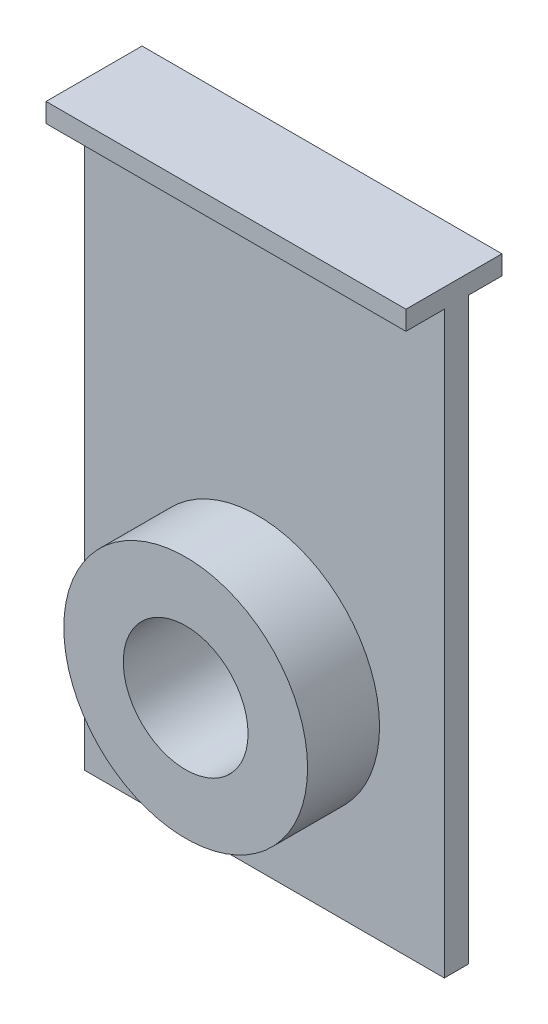
from build123d import *

# Parameters (mm, degrees)
SKETCH12_W                = 75
SKETCH12_H                = 124.71
BOSS_EXTRUDE10_DEPTH      = 5
SKETCH15_R                = 25.4
BOSS_EXTRUDE11_DEPTH      = 15
SKETCH23_R                = 13
CUT_EXTRUDE7_DEPTH        = 187.429833084
BOSS_EXTRUDE13_DEPTH      = 8
BOSS_EXTRUDE13_DEPTH_BACK = 12
SKETCH24_W                = 75
SKETCH24_H                = 4


with BuildPart() as part:
    # Sketch12 → Boss-Extrude10 (new body)
    with BuildSketch(Plane.XY):
        with Locations((99.625849364, 62.355)):
            Rectangle(SKETCH12_W, SKETCH12_H)
    extrude(amount=BOSS_EXTRUDE10_DEPTH)

    # Sketch15 → Boss-Extrude11 (add)
    with BuildSketch(Plane.XY.offset(5)):
        with Locations((98.219620603, 38.627603634)):
            Circle(SKETCH15_R)
    extrude(amount=BOSS_EXTRUDE11_DEPTH)

    # Sketch23 → Cut-Extrude7 (cut, through all)
    with BuildSketch(Plane.XY.offset(20)):
        with Locations((98.219620603, 38.627603634)):
            Circle(SKETCH23_R)
    extrude(amount=-CUT_EXTRUDE7_DEPTH, mode=Mode.SUBTRACT)

    # Sketch24 → Boss-Extrude13 (add, two sides: drawn at the far end of the back side and taken through both)
    with BuildSketch(Plane.XY.offset(5).offset(-BOSS_EXTRUDE13_DEPTH_BACK)):
        with Locations((99.625849364, 122.71)):
            Rectangle(SKETCH24_W, SKETCH24_H)
    extrude(amount=BOSS_EXTRUDE13_DEPTH + BOSS_EXTRUDE13_DEPTH_BACK)


solid = part.part
